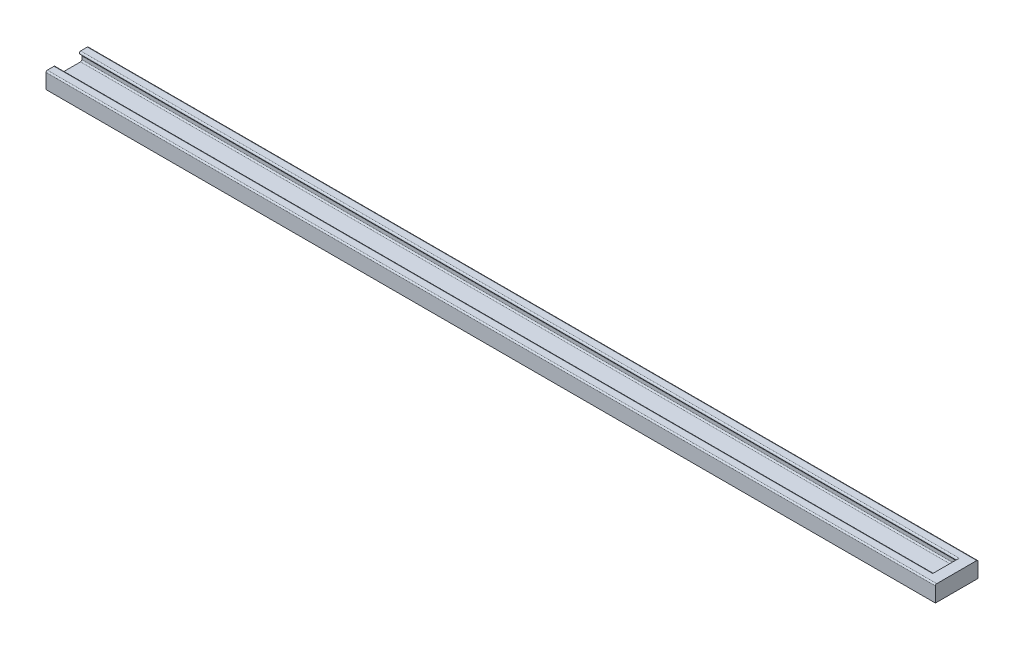
from build123d import *

# Parameters (mm, degrees)
BOSS_EXTRUDE1_DEPTH = 330
BOSS_EXTRUDE4_START = -4
BOSS_EXTRUDE4_DEPTH = 4


with BuildPart() as part:
    # Sketch1 → Boss-Extrude1 (new body)
    with BuildSketch(Plane(origin=(0, 0, 0), x_dir=(0, 0, -1), z_dir=(1, 0, 0))):
        with BuildLine():
            Line((7.9, 0), (-7.9, 0))
            Line((-7.9, 0), (-7.9, 5.5))
            ThreePointArc((-7.9, 5.5), (-7.753553391, 5.853553391), (-7.4, 6))
            Line((-7.4, 6), (-4.957106781, 6))
            ThreePointArc((-4.957106781, 6), (-4.495167015, 5.691341716), (-4.603553391, 5.146446609))
            Line((-4.603553391, 5.146446609), (-5.253553391, 4.496446609))
            ThreePointArc((-5.253553391, 4.496446609), (-5.361939766, 4.334234935), (-5.4, 4.142893219))
            Line((-5.4, 4.142893219), (-5.4, 3))
            ThreePointArc((-5.4, 3), (-5.253553391, 2.646446609), (-4.9, 2.5))
            Line((-4.9, 2.5), (4.9, 2.5))
            ThreePointArc((4.9, 2.5), (5.253553391, 2.646446609), (5.4, 3))
            Line((5.4, 3), (5.4, 4.142893219))
            ThreePointArc((5.4, 4.142893219), (5.361939766, 4.334234935), (5.253553391, 4.496446609))
            Line((5.253553391, 4.496446609), (4.603553391, 5.146446609))
            ThreePointArc((4.603553391, 5.146446609), (4.495167015, 5.691341716), (4.957106781, 6))
            Line((4.957106781, 6), (7.4, 6))
            ThreePointArc((7.4, 6), (7.753553391, 5.853553391), (7.9, 5.5))
            Line((7.9, 5.5), (7.9, 0))
        make_face()
    extrude(amount=BOSS_EXTRUDE1_DEPTH)

    # Sketch5 → Boss-Extrude4 (add)
    with BuildSketch(Plane(origin=(330, 0, 0), x_dir=(0, 0, -1), z_dir=(1, 0, 0)).offset(BOSS_EXTRUDE4_START)):
        with BuildLine():
            Line((-4.957106781, 6), (4.957106781, 6))
            Line((4.957106781, 6), (7.4, 6))
            ThreePointArc((7.4, 6), (7.753553391, 5.853553391), (7.9, 5.5))
            Line((7.9, 5.5), (7.9, 0))
            Line((7.9, 0), (-7.9, 0))
            Line((-7.9, 0), (-7.9, 5.5))
            ThreePointArc((-7.9, 5.5), (-7.753553391, 5.853553391), (-7.4, 6))
            Line((-7.4, 6), (-4.957106781, 6))
        make_face()
    extrude(amount=BOSS_EXTRUDE4_DEPTH)


solid = part.part
